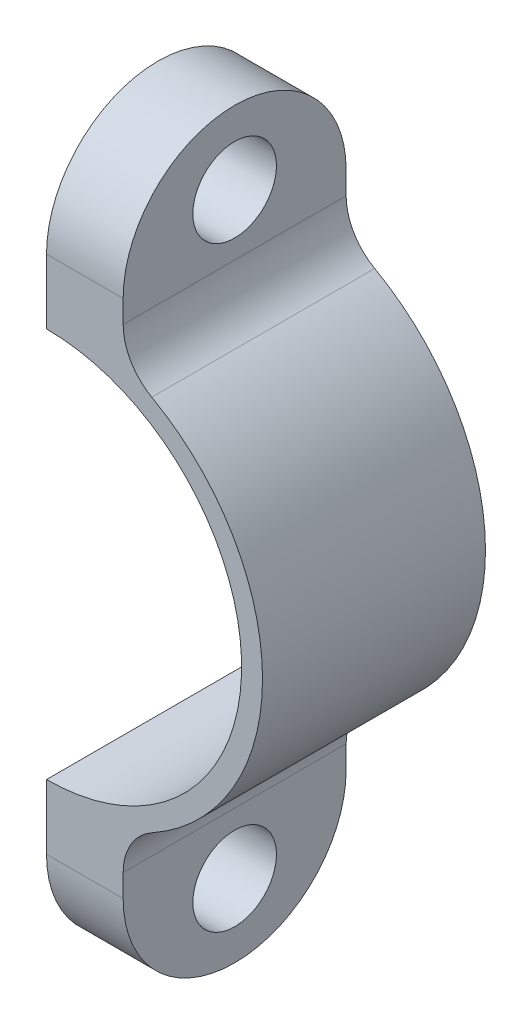
from build123d import *

# Parameters (mm, degrees)
DODANIE_WYCI_GNI_CIE1_DEPTH = 16
SZKIC2_R                    = 3
DODANIE_WYCI_GNI_CIE2_DEPTH = 5.5
ZAOKR_GLENIE1_R             = 1.5
ZAOKR_GLENIE2_R             = 4


with BuildPart() as part:
    # Szkic1 → Dodanie-wyciągnięcie1 (new body)
    with BuildSketch(Plane.XY):
        with BuildLine():
            Line((0, 15.5), (0, 14))
            ThreePointArc((0, 14), (14, 0), (0, -14))
            Line((0, -14), (0, -15.5))
            ThreePointArc((0, -15.5), (15.5, 0), (0, 15.5))
        make_face()
    extrude(amount=DODANIE_WYCI_GNI_CIE1_DEPTH)

    # Szkic2 → Dodanie-wyciągnięcie2 (add)
    # profile 1 of 2: a face of its own
    with BuildSketch(Plane.ZY):
        with BuildLine():
            ThreePointArc((16, 18.650000915), (8, 26.65), (0, 18.650000915))
            Line((0, 18.650000915), (0, 14))
            Line((0, 14), (16, 14))
            Line((16, 14), (16, 18.650000915))
        make_face()
        with Locations((8, 21.4)):
            Circle(SZKIC2_R, mode=Mode.SUBTRACT)
    # profile 2 of 2: a face of its own
    with BuildSketch(Plane.ZY):
        with BuildLine():
            Line((16, -18.650000915), (16, -14))
            Line((16, -14), (0, -14))
            Line((0, -14), (0, -18.650000915))
            ThreePointArc((0, -18.650000915), (8, -26.65), (16, -18.650000915))
        make_face()
        with Locations((8, -21.4)):
            Circle(SZKIC2_R, mode=Mode.SUBTRACT)
    extrude(amount=-DODANIE_WYCI_GNI_CIE2_DEPTH)

    # Zaokrąglenie1
    zaokr_glenie1_edges = [part.edges().sort_by_distance(p)[0] for p in [
        (14, 0, 0),
    ]]
    fillet(zaokr_glenie1_edges, radius=ZAOKR_GLENIE1_R - 0.0001)  # a hair under: the kernel refuses the full size

    # Zaokrąglenie2
    zaokr_glenie2_edges = [part.edges().sort_by_distance(p)[0] for p in [
        (5.5, -14.491376746, 8),
        (5.5, 14.491376746, 8),
    ]]
    fillet(zaokr_glenie2_edges, radius=ZAOKR_GLENIE2_R)


solid = part.part
